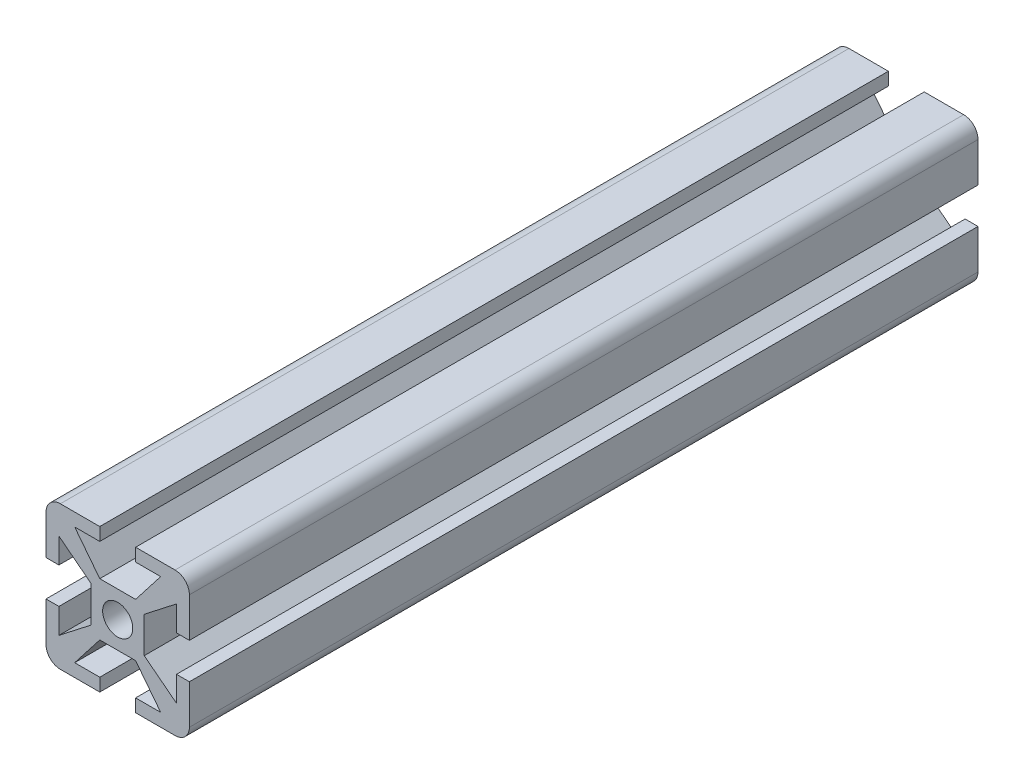
from build123d import *

# Parameters (mm, degrees)
EXTRUSION1_DEPTH        = 110
PER_AGE1_OUTLINE_R      = 2.1
PER_AGE1_DEPTH          = 110
ENL_V_MAT_EXTRU_1_DEPTH = 300
ENL_V_MAT_EXTRU_3_DEPTH = 300
ENL_V_MAT_EXTRU_4_DEPTH = 111.905365064
ENL_V_MAT_EXTRU_7_DEPTH = 111.905365064


# Read off the part's stored shape, not the designer's step: Perçage1
with BuildPart() as part:
    # Esquisse1 → Extrusion1 (new body)
    with BuildSketch(Plane.XY):
        with BuildLine():
            Line((-10, 8), (-10, -8))
            ThreePointArc((-10, -8), (-9.414213562, -9.414213562), (-8, -10))
            Line((-8, -10), (8, -10))
            ThreePointArc((8, -10), (9.414213562, -9.414213562), (10, -8))
            Line((10, -8), (10, 8))
            ThreePointArc((10, 8), (9.414213562, 9.414213562), (8, 10))
            Line((8, 10), (-8, 10))
            ThreePointArc((-8, 10), (-9.414213562, 9.414213562), (-10, 8))
        make_face()
    extrude(amount=EXTRUSION1_DEPTH)

    # Perçage1 outline → Perçage1 (cut)
    with BuildSketch(Plane.XY):
        Circle(PER_AGE1_OUTLINE_R)
    extrude(amount=PER_AGE1_DEPTH, mode=Mode.SUBTRACT)

    # Esquisse3 → Enlèv. mat.-Extru.1 (cut)
    with BuildSketch(Plane.XY.offset(110)):
        Polygon((10, 2.5), (8.2, 2.5), (8.2, 6), (3.7, 2.5), (3.7, -2.5), (8.2, -6), (8.2, -2.5), (10, -2.5), align=None)
    extrude(amount=-ENL_V_MAT_EXTRU_1_DEPTH, mode=Mode.SUBTRACT)

    # Esquisse5 → Enlèv. mat.-Extru.3 (cut)
    with BuildSketch(Plane.XY.offset(110)):
        Polygon((-2.5, 10), (-2.5, 8.2), (-6, 8.2), (-2.5, 3.7), (2.5, 3.7), (6, 8.2), (2.5, 8.2), (2.5, 10), align=None)
    extrude(amount=-ENL_V_MAT_EXTRU_3_DEPTH, mode=Mode.SUBTRACT)

    # Esquisse6 → Enlèv. mat.-Extru.4 (cut, through all)
    with BuildSketch(Plane.XY.offset(110)):
        Polygon((-2.5, -10), (-2.5, -8.2), (-6, -8.2), (-2.5, -3.7), (2.5, -3.7), (6, -8.2), (2.5, -8.2), (2.5, -10), align=None)
    extrude(amount=-ENL_V_MAT_EXTRU_4_DEPTH, mode=Mode.SUBTRACT)

    # Esquisse4 → Enlèv. mat.-Extru.7 (cut, through all)
    with BuildSketch(Plane.XY.offset(110)):
        Polygon((-10, 2.5), (-8.2, 2.5), (-8.2, 6), (-3.7, 2.5), (-3.7, -2.5), (-8.2, -6), (-8.2, -2.5), (-10, -2.5), align=None)
    extrude(amount=-ENL_V_MAT_EXTRU_7_DEPTH, mode=Mode.SUBTRACT)


solid = part.part
